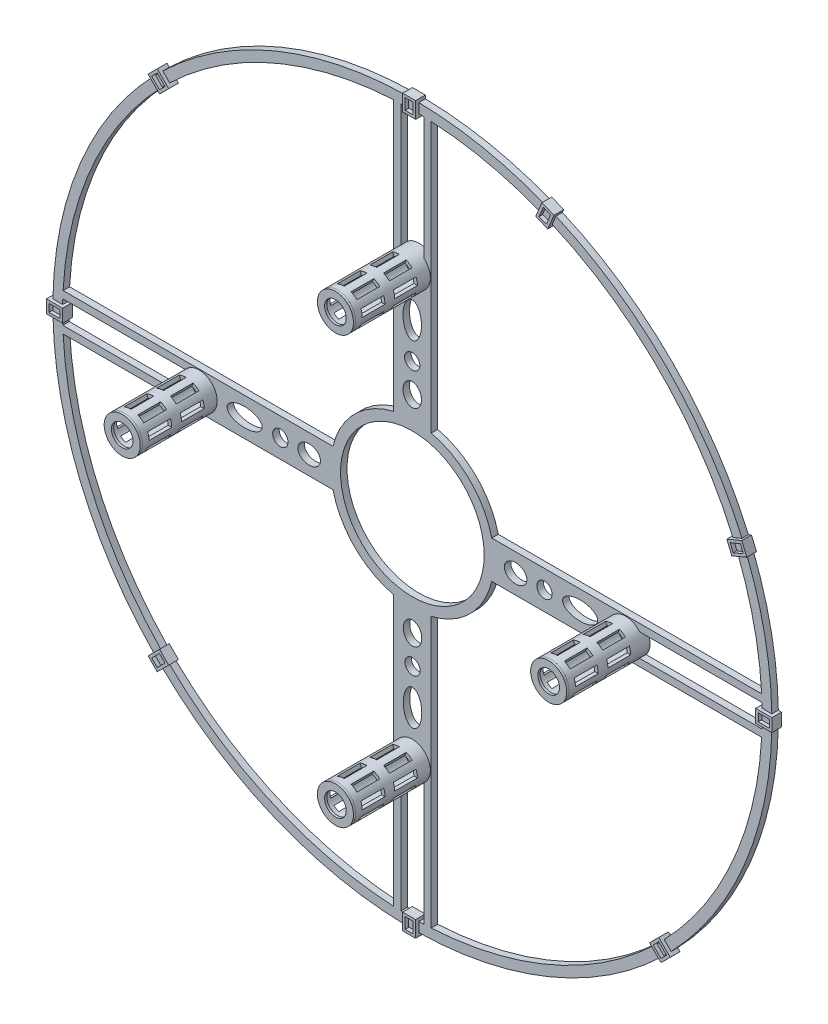
from build123d import *

# Parameters (mm, degrees)
SKETCH1_R             = 110.731806219
SKETCH1_R_2           = 4.45
SKETCH1_R_3           = 2.35
SKETCH1_R_4           = 22.125001002
BOSS_EXTRUDE1_DEPTH   = 2
SKETCH1_5_R           = 5.555670405
SKETCH1_5_R_2         = 4.45
BOSS_EXTRUDE2_DEPTH   = 25
BOSS_EXTRUDE3_DEPTH   = 3
BOSS_EXTRUDE4_START   = 25
SKETCH1_6_R           = 5.555670405
SKETCH1_6_R_2         = 3.330627044
BOSS_EXTRUDE4_DEPTH   = 0.7
BOSS_EXTRUDE4_2_DEPTH = 0.7
BOSS_EXTRUDE4_3_DEPTH = 0.7
BOSS_EXTRUDE4_4_DEPTH = 0.7
CUT_EXTRUDE1_START    = 6
CUT_EXTRUDE1_DEPTH    = 7
CUT_EXTRUDE2_START    = 16
CUT_EXTRUDE2_DEPTH    = 7
CIRPATTERN1_COUNT     = 4


# Read off the part's stored shape, not the designer's step: Cut-Extrude2
with BuildPart() as part:
    # Sketch1 → Boss-Extrude1 (new body)
    with BuildSketch(Plane.XY):
        Circle(SKETCH1_R)
        with BuildLine():
            Line((-5.785398908, 107.576350703), (-5.785398908, 24.449843247))
            ThreePointArc((-5.785398908, 24.449843247), (-17.766058586, 17.766058586), (-24.449843247, 5.785398908))
            Line((-24.449843247, 5.785398908), (-107.576350703, 5.785398908))
            ThreePointArc((-107.576350703, 5.785398908), (-76.177890727, 76.177890727), (-5.785398908, 107.576350703))
        make_face(mode=Mode.SUBTRACT)
        with BuildLine():
            Line((-3.535781308, 69.959059641), (-3.535781308, 107.673768029))
            ThreePointArc((-3.535781308, 107.673768029), (0, 107.731806219), (3.535781308, 107.673768029))
            Line((3.535781308, 107.673768029), (3.535781308, 69.959059641))
            ThreePointArc((3.535781308, 69.959059641), (0, 71.229438435), (-3.535781308, 69.959059641))
        make_face(mode=Mode.SUBTRACT)
        with BuildLine():
            Line((-107.673768029, 3.535781308), (-69.959059641, 3.535781308))
            ThreePointArc((-69.959059641, 3.535781308), (-71.229438435, 0), (-69.959059641, -3.535781308))
            Line((-69.959059641, -3.535781308), (-107.673768029, -3.535781308))
            ThreePointArc((-107.673768029, -3.535781308), (-107.731806219, 0), (-107.673768029, 3.535781308))
        make_face(mode=Mode.SUBTRACT)
        with BuildLine():
            Line((5.785398908, 24.449843247), (5.785398908, 107.576350703))
            ThreePointArc((5.785398908, 107.576350703), (76.177890727, 76.177890727), (107.576350703, 5.785398908))
            Line((107.576350703, 5.785398908), (24.449843247, 5.785398908))
            ThreePointArc((24.449843247, 5.785398908), (17.766058586, 17.766058586), (5.785398908, 24.449843247))
        make_face(mode=Mode.SUBTRACT)
        with BuildLine():
            Line((-107.576350703, -5.785398908), (-24.449843247, -5.785398908))
            ThreePointArc((-24.449843247, -5.785398908), (-17.766058586, -17.766058586), (-5.785398908, -24.449843247))
            Line((-5.785398908, -24.449843247), (-5.785398908, -107.576350703))
            ThreePointArc((-5.785398908, -107.576350703), (-76.177890727, -76.177890727), (-107.576350703, -5.785398908))
        make_face(mode=Mode.SUBTRACT)
        with BuildLine():
            Line((69.959059641, 3.535781308), (107.673768029, 3.535781308))
            ThreePointArc((107.673768029, 3.535781308), (107.731806219, 0), (107.673768029, -3.535781308))
            Line((107.673768029, -3.535781308), (69.959059641, -3.535781308))
            ThreePointArc((69.959059641, -3.535781308), (71.229438435, 0), (69.959059641, 3.535781308))
        make_face(mode=Mode.SUBTRACT)
        with BuildLine():
            Line((-3.535781308, -107.673768029), (-3.535781308, -69.959059641))
            ThreePointArc((-3.535781308, -69.959059641), (0, -71.229438435), (3.535781308, -69.959059641))
            Line((3.535781308, -69.959059641), (3.535781308, -107.673768029))
            ThreePointArc((3.535781308, -107.673768029), (0, -107.731806219), (-3.535781308, -107.673768029))
        make_face(mode=Mode.SUBTRACT)
        with BuildLine():
            Line((24.449843247, -5.785398908), (107.576350703, -5.785398908))
            ThreePointArc((107.576350703, -5.785398908), (76.177890727, -76.177890727), (5.785398908, -107.576350703))
            Line((5.785398908, -107.576350703), (5.785398908, -24.449843247))
            ThreePointArc((5.785398908, -24.449843247), (17.766058586, -17.766058586), (24.449843247, -5.785398908))
        make_face(mode=Mode.SUBTRACT)
        with Locations((0, -65.673768029)):
            Circle(SKETCH1_R_2, mode=Mode.SUBTRACT)
        with BuildLine():
            add(Edge.make_bspline(
                [(-57.073211337, -0.049199159), (-57.073211337, -4.97016034), (-48.960021633, -2.509679749), (-40.846831929, -0.049199159), (-48.960021633, 2.411281432), (-57.073211337, 4.871762022), (-57.073211337, -0.049199159)],
                knots=[0, 0, 0, 2.094395102, 2.094395102, 4.188790205, 4.188790205, 6.283185307, 6.283185307, 6.283185307], degree=2, weights=[1, 0.5, 1, 0.5, 1, 0.5, 1]))
        make_face(mode=Mode.SUBTRACT)
        with Locations((-40.67016388, -0.049199159)):
            Circle(SKETCH1_R_3, mode=Mode.SUBTRACT)
        with BuildLine():
            add(Edge.make_bspline(
                [(-35.26448641, -0.049199159), (-35.26448641, -4.97016034), (-30.045675549, -2.509679749), (-24.826864687, -0.049199159), (-30.045675549, 2.411281432), (-35.26448641, 4.871762022), (-35.26448641, -0.049199159)],
                knots=[0, 0, 0, 2.094395102, 2.094395102, 4.188790205, 4.188790205, 6.283185307, 6.283185307, 6.283185307], degree=2, weights=[1, 0.5, 1, 0.5, 1, 0.5, 1]))
        make_face(mode=Mode.SUBTRACT)
        with BuildLine():
            add(Edge.make_bspline(
                [(0.049199159, -46.255625065), (-4.871762022, -46.255625065), (-2.411281432, -54.368814769), (0.049199159, -62.482004473), (2.509679749, -54.368814769), (4.97016034, -46.255625065), (0.049199159, -46.255625065)],
                knots=[0, 0, 0, 2.094395102, 2.094395102, 4.188790205, 4.188790205, 6.283185307, 6.283185307, 6.283185307], degree=2, weights=[1, 0.5, 1, 0.5, 1, 0.5, 1]))
        make_face(mode=Mode.SUBTRACT)
        with Locations((0.049199159, -40.67016388)):
            Circle(SKETCH1_R_3, mode=Mode.SUBTRACT)
        with BuildLine():
            add(Edge.make_bspline(
                [(0.049199159, -35.26448641), (4.97016034, -35.26448641), (2.509679749, -30.045675549), (0.049199159, -24.826864687), (-2.411281432, -30.045675549), (-4.871762022, -35.26448641), (0.049199159, -35.26448641)],
                knots=[0, 0, 0, 2.094395102, 2.094395102, 4.188790205, 4.188790205, 6.283185307, 6.283185307, 6.283185307], degree=2, weights=[1, 0.5, 1, 0.5, 1, 0.5, 1]))
        make_face(mode=Mode.SUBTRACT)
        with Locations((65.673768029, 0)):
            Circle(SKETCH1_R_2, mode=Mode.SUBTRACT)
        with Locations((-65.673768029, 0)):
            Circle(SKETCH1_R_2, mode=Mode.SUBTRACT)
        with BuildLine():
            add(Edge.make_bspline(
                [(-0.049199159, 35.26448641), (-4.97016034, 35.26448641), (-2.509679749, 30.045675549), (-0.049199159, 24.826864687), (2.411281432, 30.045675549), (4.871762022, 35.26448641), (-0.049199159, 35.26448641)],
                knots=[0, 0, 0, 2.094395102, 2.094395102, 4.188790205, 4.188790205, 6.283185307, 6.283185307, 6.283185307], degree=2, weights=[1, 0.5, 1, 0.5, 1, 0.5, 1]))
        make_face(mode=Mode.SUBTRACT)
        with Locations((-0.049199159, 40.67016388)):
            Circle(SKETCH1_R_3, mode=Mode.SUBTRACT)
        with BuildLine():
            add(Edge.make_bspline(
                [(-0.049199159, 57.073211337), (-4.97016034, 57.073211337), (-2.509679749, 48.960021633), (-0.049199159, 40.846831929), (2.411281432, 48.960021633), (4.871762022, 57.073211337), (-0.049199159, 57.073211337)],
                knots=[0, 0, 0, 2.094395102, 2.094395102, 4.188790205, 4.188790205, 6.283185307, 6.283185307, 6.283185307], degree=2, weights=[1, 0.5, 1, 0.5, 1, 0.5, 1]))
        make_face(mode=Mode.SUBTRACT)
        Circle(SKETCH1_R_4, mode=Mode.SUBTRACT)
        with BuildLine():
            add(Edge.make_bspline(
                [(28.306071928, 0.049199159), (28.306071928, -4.871762022), (33.524882789, -2.411281432), (38.74369365, 0.049199159), (33.524882789, 2.509679749), (28.306071928, 4.97016034), (28.306071928, 0.049199159)],
                knots=[0, 0, 0, 2.094395102, 2.094395102, 4.188790205, 4.188790205, 6.283185307, 6.283185307, 6.283185307], degree=2, weights=[1, 0.5, 1, 0.5, 1, 0.5, 1]))
        make_face(mode=Mode.SUBTRACT)
        with Locations((40.67016388, 0.049199159)):
            Circle(SKETCH1_R_3, mode=Mode.SUBTRACT)
        with BuildLine():
            add(Edge.make_bspline(
                [(57.073211337, 0.049199159), (57.073211337, 4.97016034), (48.960021633, 2.509679749), (40.846831929, 0.049199159), (48.960021633, -2.411281432), (57.073211337, -4.871762022), (57.073211337, 0.049199159)],
                knots=[0, 0, 0, 2.094395102, 2.094395102, 4.188790205, 4.188790205, 6.283185307, 6.283185307, 6.283185307], degree=2, weights=[1, 0.5, 1, 0.5, 1, 0.5, 1]))
        make_face(mode=Mode.SUBTRACT)
        with Locations((0, 65.673768029)):
            Circle(SKETCH1_R_2, mode=Mode.SUBTRACT)
    extrude(amount=BOSS_EXTRUDE1_DEPTH)

    # Sketch1<5> → Boss-Extrude2 (add)
    # profile 1 of 4: a face of its own
    with BuildSketch(Plane.XY):
        with Locations(Location((0, 65.673768029, 0), (0, 0, 129.525938475))):
            Circle(SKETCH1_5_R)
        with Locations((0, 65.673768029)):
            Circle(SKETCH1_5_R_2, mode=Mode.SUBTRACT)
    # profile 2 of 4: a face of its own
    with BuildSketch(Plane.XY):
        with Locations(Location((65.673768029, 0, 0), (0, 0, 320.474061525))):
            Circle(SKETCH1_5_R)
        with Locations((65.673768029, 0)):
            Circle(SKETCH1_5_R_2, mode=Mode.SUBTRACT)
    # profile 3 of 4: a face of its own
    with BuildSketch(Plane.XY):
        with Locations(Location((0, -65.673768029, 0), (0, 0, 230.474061525))):
            Circle(SKETCH1_5_R)
        with Locations((0, -65.673768029)):
            Circle(SKETCH1_5_R_2, mode=Mode.SUBTRACT)
    # profile 4 of 4: a face of its own
    with BuildSketch(Plane.XY):
        with Locations(Location((-65.673768029, 0, 0), (0, 0, 219.525938475))):
            Circle(SKETCH1_5_R)
        with Locations((-65.673768029, 0)):
            Circle(SKETCH1_5_R_2, mode=Mode.SUBTRACT)
    extrude(amount=BOSS_EXTRUDE2_DEPTH)

    # Sketch3 → Boss-Extrude3 (add)
    # profile 1 of 9: a face of its own
    with BuildSketch(Plane.XY):
        with BuildLine():
            ThreePointArc((-74.043319059, 76.871746184), (-75.470783945, 75.470783945), (-76.871746184, 74.043319059))
            Line((-76.871746184, 74.043319059), (-80.407873184, 77.579446059))
            ThreePointArc((-80.407873184, 77.579446059), (-79.006317851, 79.006317851), (-77.579446059, 80.407873184))
            Line((-77.579446059, 80.407873184), (-74.043319059, 76.871746184))
        make_face()
        with BuildLine():
            Line((-75.183206515, 76.88026279), (-77.587514697, 79.284570971))
            ThreePointArc((-77.587514697, 79.284570971), (-78.440632426, 78.440632426), (-79.284570971, 77.587514697))
            Line((-79.284570971, 77.587514697), (-76.88026279, 75.183206515))
            ThreePointArc((-76.88026279, 75.183206515), (-76.03646937, 76.03646937), (-75.183206515, 76.88026279))
        make_face(mode=Mode.SUBTRACT)
    # profile 2 of 9: a face of its own
    with BuildSketch(Plane.XY):
        with BuildLine():
            ThreePointArc((2, 106.713066017), (0, 106.731806219), (-2, 106.713066017))
            Line((-2, 106.713066017), (-2, 111.713904778))
            ThreePointArc((-2, 111.713904778), (0, 111.731806219), (2, 111.713904778))
            Line((2, 111.713904778), (2, 106.713066017))
        make_face()
        with BuildLine():
            Line((1.2, 107.525110317), (1.2, 110.925315555))
            ThreePointArc((1.2, 110.925315555), (0, 110.931806219), (-1.2, 110.925315555))
            Line((-1.2, 110.925315555), (-1.2, 107.525110317))
            ThreePointArc((-1.2, 107.525110317), (0, 107.531806219), (1.2, 107.525110317))
        make_face(mode=Mode.SUBTRACT)
    # profile 3 of 9: a face of its own
    with BuildSketch(Plane.XY):
        with BuildLine():
            ThreePointArc((42.685081446, 97.82465068), (40.844493946, 98.607331233), (38.989563316, 99.355384409))
            Line((38.989563316, 99.355384409), (40.903301459, 103.975556986))
            ThreePointArc((40.903301459, 103.975556986), (42.757911108, 103.226728896), (44.598819589, 102.444823257))
            Line((44.598819589, 102.444823257), (42.685081446, 97.82465068))
        make_face()
        with BuildLine():
            ThreePointArc((43.557935932, 102.022408559), (42.451764362, 102.48762527), (41.340625054, 102.940848797))
            Line((41.340625054, 102.940848797), (40.039422842, 99.799468771))
            ThreePointArc((40.039422842, 99.799468771), (41.150640692, 99.346434859), (42.25673372, 98.881028534))
            Line((42.25673372, 98.881028534), (43.557935932, 102.022408559))
        make_face(mode=Mode.SUBTRACT)
    # profile 4 of 9: a face of its own
    with BuildSketch(Plane.XY):
        with BuildLine():
            ThreePointArc((102.444823257, 44.598819589), (103.226728896, 42.757911108), (103.975556986, 40.903301459))
            Line((103.975556986, 40.903301459), (99.355384409, 38.989563316))
            ThreePointArc((99.355384409, 38.989563316), (98.607331233, 40.844493946), (97.82465068, 42.685081446))
            Line((97.82465068, 42.685081446), (102.444823257, 44.598819589))
        make_face()
        with BuildLine():
            Line((98.881028534, 42.25673372), (102.022408559, 43.557935932))
            ThreePointArc((102.022408559, 43.557935932), (102.48762527, 42.451764362), (102.940848797, 41.340625054))
            Line((102.940848797, 41.340625054), (99.799468771, 40.039422842))
            ThreePointArc((99.799468771, 40.039422842), (99.346434859, 41.150640692), (98.881028534, 42.25673372))
        make_face(mode=Mode.SUBTRACT)
    # profile 5 of 9: a face of its own
    with BuildSketch(Plane.XY):
        with BuildLine():
            ThreePointArc((106.713066017, -2), (106.731806219, 0), (106.713066017, 2))
            Line((106.713066017, 2), (111.713904778, 2))
            ThreePointArc((111.713904778, 2), (111.731806219, 0), (111.713904778, -2))
            Line((111.713904778, -2), (106.713066017, -2))
        make_face()
        with BuildLine():
            Line((107.525110317, -1.2), (110.925315555, -1.2))
            ThreePointArc((110.925315555, -1.2), (110.931806219, 0), (110.925315555, 1.2))
            Line((110.925315555, 1.2), (107.525110317, 1.2))
            ThreePointArc((107.525110317, 1.2), (107.531806219, 0), (107.525110317, -1.2))
        make_face(mode=Mode.SUBTRACT)
    # profile 6 of 9: a face of its own
    with BuildSketch(Plane.XY):
        with BuildLine():
            ThreePointArc((74.043319059, -76.871746184), (75.470783945, -75.470783945), (76.871746184, -74.043319059))
            Line((76.871746184, -74.043319059), (80.407873184, -77.579446059))
            ThreePointArc((80.407873184, -77.579446059), (79.006317851, -79.006317851), (77.579446059, -80.407873184))
            Line((77.579446059, -80.407873184), (74.043319059, -76.871746184))
        make_face()
        with BuildLine():
            Line((75.183206515, -76.88026279), (77.587514697, -79.284570971))
            ThreePointArc((77.587514697, -79.284570971), (78.440632426, -78.440632426), (79.284570971, -77.587514697))
            Line((79.284570971, -77.587514697), (76.88026279, -75.183206515))
            ThreePointArc((76.88026279, -75.183206515), (76.03646937, -76.03646937), (75.183206515, -76.88026279))
        make_face(mode=Mode.SUBTRACT)
    # profile 7 of 9: a face of its own
    with BuildSketch(Plane.XY):
        with BuildLine():
            ThreePointArc((-2, -106.713066017), (0, -106.731806219), (2, -106.713066017))
            Line((2, -106.713066017), (2, -111.713904778))
            ThreePointArc((2, -111.713904778), (0, -111.731806219), (-2, -111.713904778))
            Line((-2, -111.713904778), (-2, -106.713066017))
        make_face()
        with BuildLine():
            Line((-1.2, -107.525110317), (-1.2, -110.925315555))
            ThreePointArc((-1.2, -110.925315555), (0, -110.931806219), (1.2, -110.925315555))
            Line((1.2, -110.925315555), (1.2, -107.525110317))
            ThreePointArc((1.2, -107.525110317), (0, -107.531806219), (-1.2, -107.525110317))
        make_face(mode=Mode.SUBTRACT)
    # profile 8 of 9: a face of its own
    with BuildSketch(Plane.XY):
        with BuildLine():
            ThreePointArc((-76.871746184, -74.043319059), (-75.470783945, -75.470783945), (-74.043319059, -76.871746184))
            Line((-74.043319059, -76.871746184), (-77.579446059, -80.407873184))
            ThreePointArc((-77.579446059, -80.407873184), (-79.006317851, -79.006317851), (-80.407873184, -77.579446059))
            Line((-80.407873184, -77.579446059), (-76.871746184, -74.043319059))
        make_face()
        with BuildLine():
            Line((-76.88026279, -75.183206515), (-79.284570971, -77.587514697))
            ThreePointArc((-79.284570971, -77.587514697), (-78.440632426, -78.440632426), (-77.587514697, -79.284570971))
            Line((-77.587514697, -79.284570971), (-75.183206515, -76.88026279))
            ThreePointArc((-75.183206515, -76.88026279), (-76.03646937, -76.03646937), (-76.88026279, -75.183206515))
        make_face(mode=Mode.SUBTRACT)
    # profile 9 of 9: a face of its own
    with BuildSketch(Plane.XY):
        with BuildLine():
            ThreePointArc((-106.713066017, 2), (-106.731806219, 0), (-106.713066017, -2))
            Line((-106.713066017, -2), (-111.713904778, -2))
            ThreePointArc((-111.713904778, -2), (-111.731806219, 0), (-111.713904778, 2))
            Line((-111.713904778, 2), (-106.713066017, 2))
        make_face()
        with BuildLine():
            Line((-107.525110317, 1.2), (-110.925315555, 1.2))
            ThreePointArc((-110.925315555, 1.2), (-110.931806219, 0), (-110.925315555, -1.2))
            Line((-110.925315555, -1.2), (-107.525110317, -1.2))
            ThreePointArc((-107.525110317, -1.2), (-107.531806219, 0), (-107.525110317, 1.2))
        make_face(mode=Mode.SUBTRACT)
    extrude(amount=BOSS_EXTRUDE3_DEPTH)

    # Sketch4 → Cut-Extrude1 (cut)
    with BuildSketch(Plane.XY.offset(CUT_EXTRUDE1_START)):
        with BuildLine():
            Line((2.12606302, 60.540997853), (1.702941274, 61.56250411))
            ThreePointArc((1.702941274, 61.56250411), (0.868151933, 61.309273532), (0, 61.223768029))
            Line((0, 61.223768029), (0, 60.118097624))
            ThreePointArc((0, 60.118097624), (1.083857528, 60.224848273), (2.12606302, 60.540997853))
        make_face()
        with BuildLine():
            Line((5.132770177, 63.54770501), (4.11126392, 63.970826755))
            ThreePointArc((4.11126392, 63.970826755), (3.700039775, 63.201480492), (3.146625176, 62.527142853))
            Line((3.146625176, 62.527142853), (3.928452218, 61.745315812))
            ThreePointArc((3.928452218, 61.745315812), (4.619371118, 62.587202928), (5.132770177, 63.54770501))
        make_face()
        with BuildLine():
            Line((5.132770177, 67.799831049), (4.11126392, 67.376709303))
            ThreePointArc((4.11126392, 67.376709303), (4.364494498, 66.541919962), (4.45, 65.673768029))
            Line((4.45, 65.673768029), (5.555670405, 65.673768029))
            ThreePointArc((5.555670405, 65.673768029), (5.448919756, 66.757625558), (5.132770177, 67.799831049))
        make_face()
        with BuildLine():
            Line((2.12606302, 70.806538206), (1.702941274, 69.785031949))
            ThreePointArc((1.702941274, 69.785031949), (2.472287537, 69.373807804), (3.146625176, 68.820393206))
            Line((3.146625176, 68.820393206), (3.928452218, 69.602220247))
            ThreePointArc((3.928452218, 69.602220247), (3.086565102, 70.293139147), (2.12606302, 70.806538206))
        make_face()
        with BuildLine():
            ThreePointArc((-1.702941274, 69.785031949), (-0.868151933, 70.038262527), (0, 70.123768029))
            Line((0, 70.123768029), (0, 71.229438435))
            ThreePointArc((0, 71.229438435), (-1.083857528, 71.122687786), (-2.12606302, 70.806538206))
            Line((-2.12606302, 70.806538206), (-1.702941274, 69.785031949))
        make_face()
        with BuildLine():
            ThreePointArc((-4.11126392, 67.376709303), (-3.700039775, 68.146055566), (-3.146625176, 68.820393206))
            Line((-3.146625176, 68.820393206), (-3.928452218, 69.602220247))
            ThreePointArc((-3.928452218, 69.602220247), (-4.619371118, 68.760333131), (-5.132770177, 67.799831049))
            Line((-5.132770177, 67.799831049), (-4.11126392, 67.376709303))
        make_face()
        with BuildLine():
            ThreePointArc((-4.11126392, 63.970826755), (-4.364494498, 64.805616096), (-4.45, 65.673768029))
            Line((-4.45, 65.673768029), (-5.555670405, 65.673768029))
            ThreePointArc((-5.555670405, 65.673768029), (-5.448919756, 64.589910501), (-5.132770177, 63.54770501))
            Line((-5.132770177, 63.54770501), (-4.11126392, 63.970826755))
        make_face()
        with BuildLine():
            ThreePointArc((-1.702941274, 61.56250411), (-2.472287537, 61.973728255), (-3.146625176, 62.527142853))
            Line((-3.146625176, 62.527142853), (-3.928452218, 61.745315812))
            ThreePointArc((-3.928452218, 61.745315812), (-3.086565102, 61.054396912), (-2.12606302, 60.540997853))
            Line((-2.12606302, 60.540997853), (-1.702941274, 61.56250411))
        make_face()
    cut_extrude1 = extrude(amount=CUT_EXTRUDE1_DEPTH, mode=Mode.SUBTRACT)

    # Cut-Extrude2 outline → Cut-Extrude2 (cut)
    with BuildSketch(Plane.XY.offset(CUT_EXTRUDE2_START)):
        with BuildLine():
            ThreePointArc((1.702941274, 61.562504109), (0.868151933, 61.309273531), (0, 61.223768029))
            Line((0, 61.223768029), (0, 60.118097624))
            ThreePointArc((0, 60.118097624), (1.083857529, 60.224848273), (2.12606302, 60.540997853))
            Line((2.12606302, 60.540997853), (1.702941274, 61.562504109))
        make_face()
        with BuildLine():
            Line((-2.12606302, 60.540997853), (-1.702941274, 61.562504109))
            ThreePointArc((-1.702941274, 61.562504109), (-2.472287537, 61.973728254), (-3.146625176, 62.527142853))
            Line((-3.146625176, 62.527142853), (-3.928452218, 61.745315812))
            ThreePointArc((-3.928452218, 61.745315812), (-3.086565102, 61.054396912), (-2.12606302, 60.540997853))
        make_face()
        with BuildLine():
            ThreePointArc((4.11126392, 63.970826755), (3.700039775, 63.201480492), (3.146625176, 62.527142853))
            Line((3.146625176, 62.527142853), (3.928452218, 61.745315812))
            ThreePointArc((3.928452218, 61.745315812), (4.619371118, 62.587202928), (5.132770177, 63.54770501))
            Line((5.132770177, 63.54770501), (4.11126392, 63.970826755))
        make_face()
        with BuildLine():
            Line((-5.132770177, 63.54770501), (-4.11126392, 63.970826755))
            ThreePointArc((-4.11126392, 63.970826755), (-4.364494498, 64.805616096), (-4.45, 65.673768029))
            Line((-4.45, 65.673768029), (-5.555670405, 65.673768029))
            ThreePointArc((-5.555670405, 65.673768029), (-5.448919756, 64.589910501), (-5.132770177, 63.54770501))
        make_face()
        with BuildLine():
            ThreePointArc((4.11126392, 67.376709303), (4.364494498, 66.541919962), (4.45, 65.673768029))
            Line((4.45, 65.673768029), (5.555670405, 65.673768029))
            ThreePointArc((5.555670405, 65.673768029), (5.448919756, 66.757625557), (5.132770177, 67.799831049))
            Line((5.132770177, 67.799831049), (4.11126392, 67.376709303))
        make_face()
        with BuildLine():
            Line((-5.132770177, 67.799831049), (-4.11126392, 67.376709303))
            ThreePointArc((-4.11126392, 67.376709303), (-3.700039775, 68.146055566), (-3.146625176, 68.820393206))
            Line((-3.146625176, 68.820393206), (-3.928452217, 69.602220246))
            ThreePointArc((-3.928452217, 69.602220246), (-4.619371118, 68.760333131), (-5.132770177, 67.799831049))
        make_face()
        with BuildLine():
            ThreePointArc((1.702941274, 69.785031949), (2.472287537, 69.373807804), (3.146625176, 68.820393206))
            Line((3.146625176, 68.820393206), (3.928452217, 69.602220246))
            ThreePointArc((3.928452217, 69.602220246), (3.086565102, 70.293139147), (2.12606302, 70.806538206))
            Line((2.12606302, 70.806538206), (1.702941274, 69.785031949))
        make_face()
        with BuildLine():
            Line((-2.12606302, 70.806538206), (-1.702941274, 69.785031949))
            ThreePointArc((-1.702941274, 69.785031949), (-0.868151933, 70.038262527), (0, 70.123768029))
            Line((0, 70.123768029), (0, 71.229438434))
            ThreePointArc((0, 71.229438434), (-1.083857528, 71.122687785), (-2.12606302, 70.806538206))
        make_face()
    cut_extrude2 = extrude(amount=CUT_EXTRUDE2_DEPTH, mode=Mode.SUBTRACT)

    # CirPattern1: Cut-Extrude1, Cut-Extrude2 ×4 about axis
    cirpattern1_axis = Axis((0, 0, 0), (0, 0, 1))
    add([cut_extrude1.rotate(cirpattern1_axis, i * 360 / CIRPATTERN1_COUNT) for i in range(1, CIRPATTERN1_COUNT)], mode=Mode.SUBTRACT)
    add([cut_extrude2.rotate(cirpattern1_axis, i * 360 / CIRPATTERN1_COUNT) for i in range(1, CIRPATTERN1_COUNT)], mode=Mode.SUBTRACT)


with BuildPart() as body_2:
    # Sketch1<6> → Boss-Extrude4 (new body)
    with BuildSketch(Plane.XY.offset(BOSS_EXTRUDE4_START)):
        with Locations((0, 65.673768029)):
            Circle(SKETCH1_6_R)
        with Locations((0, 65.673768029)):
            Circle(SKETCH1_6_R_2, mode=Mode.SUBTRACT)
    extrude(amount=BOSS_EXTRUDE4_DEPTH)


with BuildPart() as body_3:
    # Sketch1<6> → Boss-Extrude4 2 (new body)
    with BuildSketch(Plane.XY.offset(BOSS_EXTRUDE4_START)):
        with Locations((65.673768029, 0)):
            Circle(SKETCH1_6_R)
        with Locations((65.673768029, 0)):
            Circle(SKETCH1_6_R_2, mode=Mode.SUBTRACT)
    extrude(amount=BOSS_EXTRUDE4_2_DEPTH)


with BuildPart() as body_4:
    # Sketch1<6> → Boss-Extrude4 3 (new body)
    with BuildSketch(Plane.XY.offset(BOSS_EXTRUDE4_START)):
        with Locations((0, -65.673768029)):
            Circle(SKETCH1_6_R)
        with Locations((0, -65.673768029)):
            Circle(SKETCH1_6_R_2, mode=Mode.SUBTRACT)
    extrude(amount=BOSS_EXTRUDE4_3_DEPTH)


with BuildPart() as body_5:
    # Sketch1<6> → Boss-Extrude4 4 (new body)
    with BuildSketch(Plane.XY.offset(BOSS_EXTRUDE4_START)):
        with Locations((-65.673768029, 0)):
            Circle(SKETCH1_6_R)
        with Locations((-65.673768029, 0)):
            Circle(SKETCH1_6_R_2, mode=Mode.SUBTRACT)
    extrude(amount=BOSS_EXTRUDE4_4_DEPTH)


solid = Compound([part.part, body_2.part, body_3.part, body_4.part, body_5.part])
